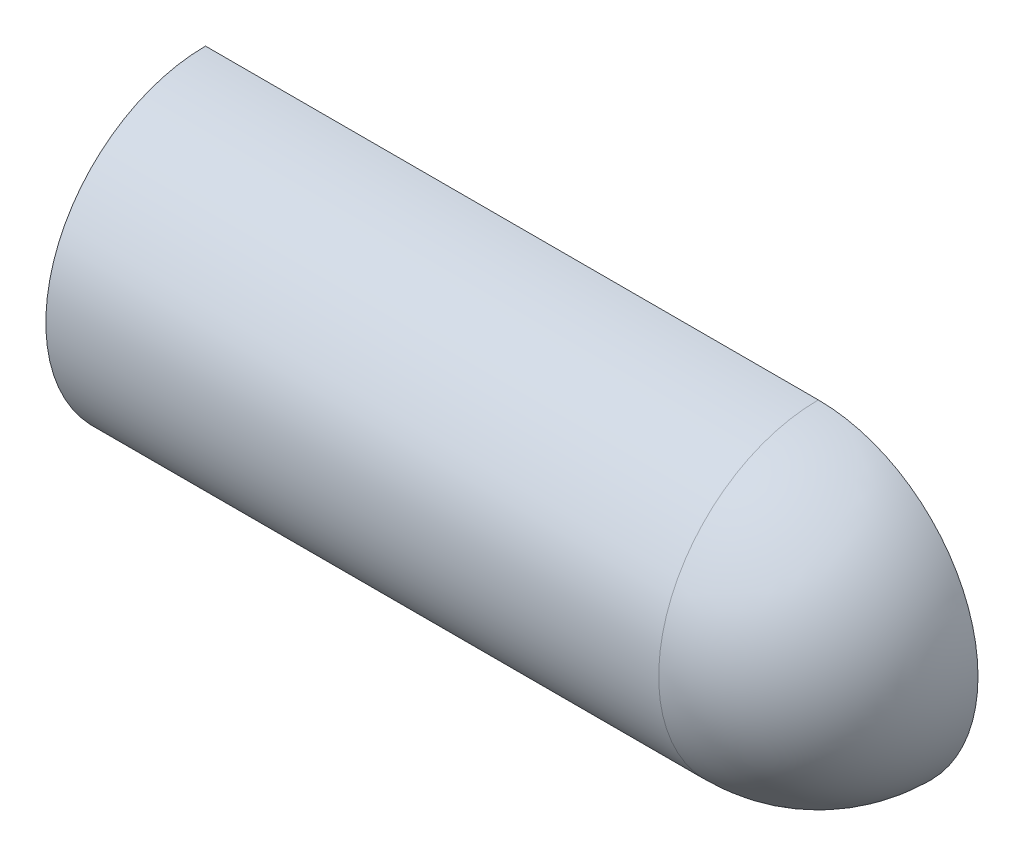
from build123d import *

# Parameters (mm, degrees)
REVOLVE1_ANGLE = 180


with BuildPart() as part:
    # Sketch2 → Revolve1 (revolve)
    with BuildSketch(Plane.XY):
        with BuildLine():
            Line((26.000000502, 0), (30.99999996, 0))
            ThreePointArc((30.99999996, 0), (21.920309999, 21.920309852), (0, 31))
            Line((0, 31), (-119, 31))
            Line((-119, 31), (-119, 26))
            Line((-119, 26), (-4e-08, 26))
            ThreePointArc((-4e-08, 26), (18.384776462, 18.384776344), (26.000000502, 0))
        make_face()
    revolve(axis=Axis((26.000000502, 0, 0), (1, 0, 0)), revolution_arc=REVOLVE1_ANGLE)


solid = part.part
